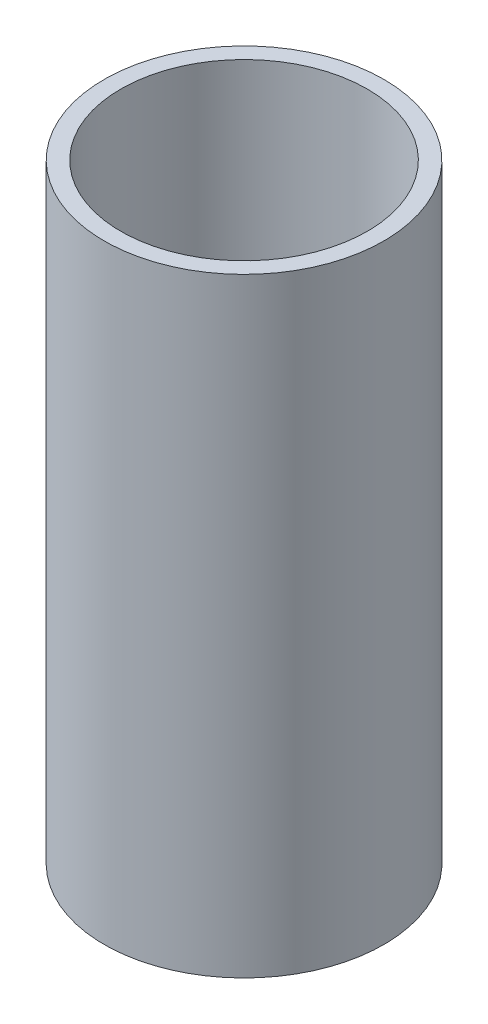
from build123d import *

# Parameters (mm, degrees)
SKETCH1_R           = 40
BOSS_EXTRUDE1_DEPTH = 174.217820619
SKETCH2_R           = 35.246105993
CUT_EXTRUDE1_DEPTH  = 184.171638146


with BuildPart() as part:
    # Sketch1 → Boss-Extrude1 (new body)
    with BuildSketch(Plane(origin=(0, 0, 0), x_dir=(1, 0, 0), z_dir=(0, 1, 0))):
        Circle(SKETCH1_R)
    extrude(amount=BOSS_EXTRUDE1_DEPTH)

    # Sketch2 → Cut-Extrude1 (cut, through all)
    with BuildSketch(Plane(origin=(0, 0, 0), x_dir=(1, 0, 0), z_dir=(0, 1, 0))):
        Circle(SKETCH2_R)
    extrude(amount=CUT_EXTRUDE1_DEPTH, mode=Mode.SUBTRACT)


solid = part.part
